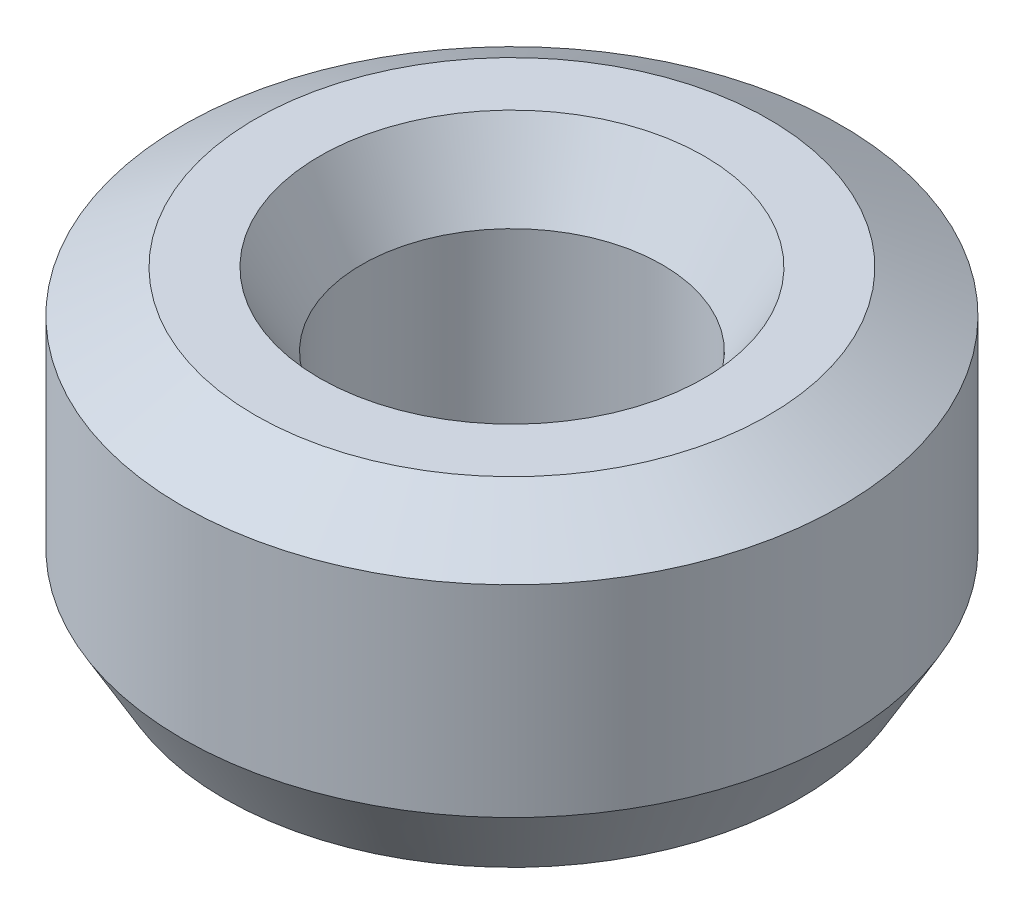
from build123d import *
from OCP.BRepFilletAPI import BRepFilletAPI_MakeChamfer

# Parameters (mm, degrees)
SKETCH1_R           = 27.5
BOSS_EXTRUDE1_DEPTH = 26.416666645
SKETCH2_R           = 12.536968875
CUT_EXTRUDE1_DEPTH  = 48.0142561
CHAMFER1_SIZE       = 3.512878415
CHAMFER1_SIZE2      = 6.084483895


with BuildPart() as part:
    # Sketch1 → Boss-Extrude1 (new body)
    with BuildSketch(Plane(origin=(0, 0, 0), x_dir=(1, 0, 0), z_dir=(0, 1, 0))):
        Circle(SKETCH1_R)
    extrude(amount=BOSS_EXTRUDE1_DEPTH)

    # Sketch2 → Cut-Extrude1 (cut, through all)
    with BuildSketch(Plane(origin=(0, 0, 0), x_dir=(1, 0, 0), z_dir=(0, 1, 0))):
        Circle(SKETCH2_R)
    extrude(amount=CUT_EXTRUDE1_DEPTH, mode=Mode.SUBTRACT)

    # Chamfer1: one chamfer whose edges measure the first distance from different faces: ONE call of the kernel's chamfer builder (chamfer() names one face for all edges)
    chamfer1_edges_1 = [part.edges().sort_by_distance(p)[0] for p in [
        (-12.536968875, 26.416666645, 0),
    ]]
    chamfer1_side_1 = [part.faces().sort_by_distance(p)[0] for p in [
        (-26.722182541, 26.416666645, 0),
    ]]
    chamfer1_edges_2 = [part.edges().sort_by_distance(p)[0] for p in [
        (-12.536968875, 0, 0),
    ]]
    chamfer1_side_2 = [part.faces().sort_by_distance(p)[0] for p in [
        (-12.536968875, 13.208333322, 0),
    ]]
    chamfer1_edges_3 = [part.edges().sort_by_distance(p)[0] for p in [
        (-27.5, 0, 0),
    ]]
    chamfer1_side_3 = [part.faces().sort_by_distance(p)[0] for p in [
        (-26.722182541, 0, 0),
    ]]
    chamfer1_edges_4 = [part.edges().sort_by_distance(p)[0] for p in [
        (-27.5, 26.416666645, 0),
    ]]
    chamfer1_side_4 = [part.faces().sort_by_distance(p)[0] for p in [
        (-27.5, 13.208333322, 0),
    ]]
    chamfer1 = BRepFilletAPI_MakeChamfer(part.part.solid().wrapped)
    for e in chamfer1_edges_1:
        chamfer1.Add(CHAMFER1_SIZE, CHAMFER1_SIZE2, e.wrapped, chamfer1_side_1[0].wrapped)  # the first distance lies on this face
    for e in chamfer1_edges_2:
        chamfer1.Add(CHAMFER1_SIZE, CHAMFER1_SIZE2, e.wrapped, chamfer1_side_2[0].wrapped)  # the first distance lies on this face
    for e in chamfer1_edges_3:
        chamfer1.Add(CHAMFER1_SIZE, CHAMFER1_SIZE2, e.wrapped, chamfer1_side_3[0].wrapped)  # the first distance lies on this face
    for e in chamfer1_edges_4:
        chamfer1.Add(CHAMFER1_SIZE, CHAMFER1_SIZE2, e.wrapped, chamfer1_side_4[0].wrapped)  # the first distance lies on this face
    add(Compound.cast(chamfer1.Shape()), mode=Mode.REPLACE)


solid = part.part
